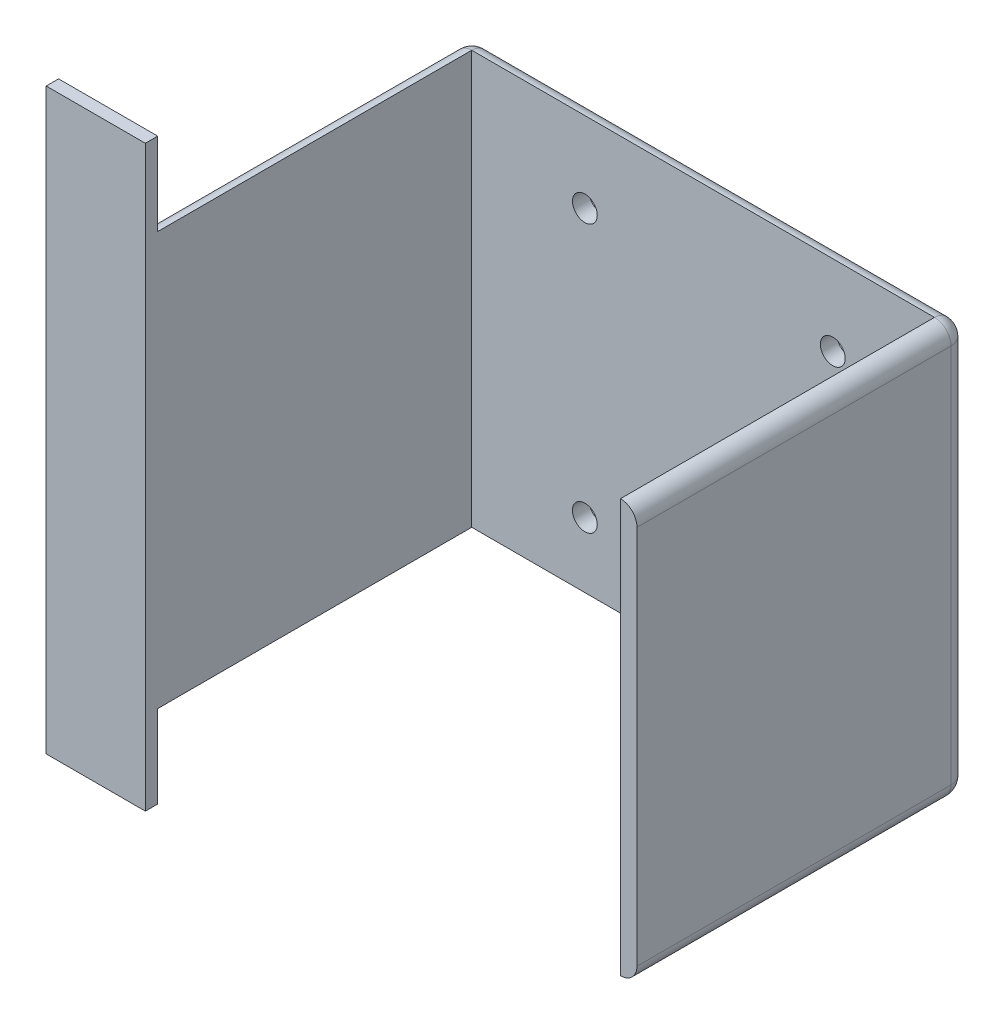
from build123d import *

# Parameters (mm, degrees)
SKETCH1_W                 = 60
SKETCH1_H                 = 50
BOSS_EXTRUDE1_DEPTH       = 40
SKETCH2_W                 = 70
SKETCH2_H                 = 70
BOSS_EXTRUDE2_DEPTH       = 1.5
SHELL1_START              = -28
SHELL1_OUTLINE_W          = 46
SHELL1_OUTLINE_H          = 39.5
SHELL1_DEPTH              = 56
F_3_0MM_DOWEL_HOLE2_D     = 3
F_3_0MM_DOWEL_HOLE2_DEPTH = 41.499
FILLET1_R                 = 2
CUT_EXTRUDE2_DEPTH        = 84.200060096
CUT_EXTRUDE2_DEPTH_BACK   = 84.200060096
SKETCH8_W                 = 56
SKETCH8_H                 = 39.5
SKETCH9_W                 = 1.5
SKETCH9_H                 = 70
CUT_EXTRUDE3_DEPTH        = 2


# Read off the part's stored shape, not the designer's step: Shell1
with BuildPart() as part:
    # Sketch1 → Boss-Extrude1 (new body)
    with BuildSketch(Plane.XY):
        Rectangle(SKETCH1_W, SKETCH1_H)
    extrude(amount=BOSS_EXTRUDE1_DEPTH)

    # Sketch2 → Boss-Extrude2 (add)
    with BuildSketch(Plane.XY.offset(40)):
        with Locations((-5, 0)):
            Rectangle(SKETCH2_W, SKETCH2_H)
    extrude(amount=BOSS_EXTRUDE2_DEPTH)

    # Shell1 outline → Shell1 (cut)
    with BuildSketch(Plane.YZ.offset(SHELL1_START)):
        with Locations((0, 21.75)):
            Rectangle(SHELL1_OUTLINE_W, SHELL1_OUTLINE_H)
    extrude(amount=SHELL1_DEPTH, mode=Mode.SUBTRACT)

    # Ø3.0mm Dowel Hole2
    with Locations(Plane(origin=(-311.781139065, -231.688044449, 0), x_dir=(-1, 0, 0), z_dir=(0, 0, -1))):
        with Locations((-327.471139065, 246.969744449), (-297.471139065, 246.969744449), (-297.471139065, 214.569744449), (-327.471139065, 214.569744449)):
            Hole(F_3_0MM_DOWEL_HOLE2_D / 2, depth=F_3_0MM_DOWEL_HOLE2_DEPTH)

    # Fillet1
    fillet1_edges = [part.edges().sort_by_distance(p)[0] for p in [
        (0, -25, 0),
        (-30, 0, 0),
        (0, 25, 0),
        (30, 0, 0),
        (30, -25, 20),
        (-30, -25, 20),
        (-30, 25, 20),
        (30, 25, 20),
    ]]
    fillet(fillet1_edges, radius=FILLET1_R)

    # Sketch8 → Cut-Extrude2 (cut, two sides: drawn at the far end of the back side and taken through both)
    with BuildSketch(Plane.XZ.offset(25).offset(-CUT_EXTRUDE2_DEPTH_BACK)):
        with Locations((0, 21.75)):
            Rectangle(SKETCH8_W, SKETCH8_H)
    extrude(amount=CUT_EXTRUDE2_DEPTH + CUT_EXTRUDE2_DEPTH_BACK, mode=Mode.SUBTRACT)

    # Sketch9 → Cut-Extrude3 (cut)
    with BuildSketch(Plane(origin=(30, 0, 0), x_dir=(0, 0, -1), z_dir=(1, 0, 0))):
        with Locations((-40.75, 0)):
            Rectangle(SKETCH9_W, SKETCH9_H)
    extrude(amount=-CUT_EXTRUDE3_DEPTH, mode=Mode.SUBTRACT)


solid = part.part
